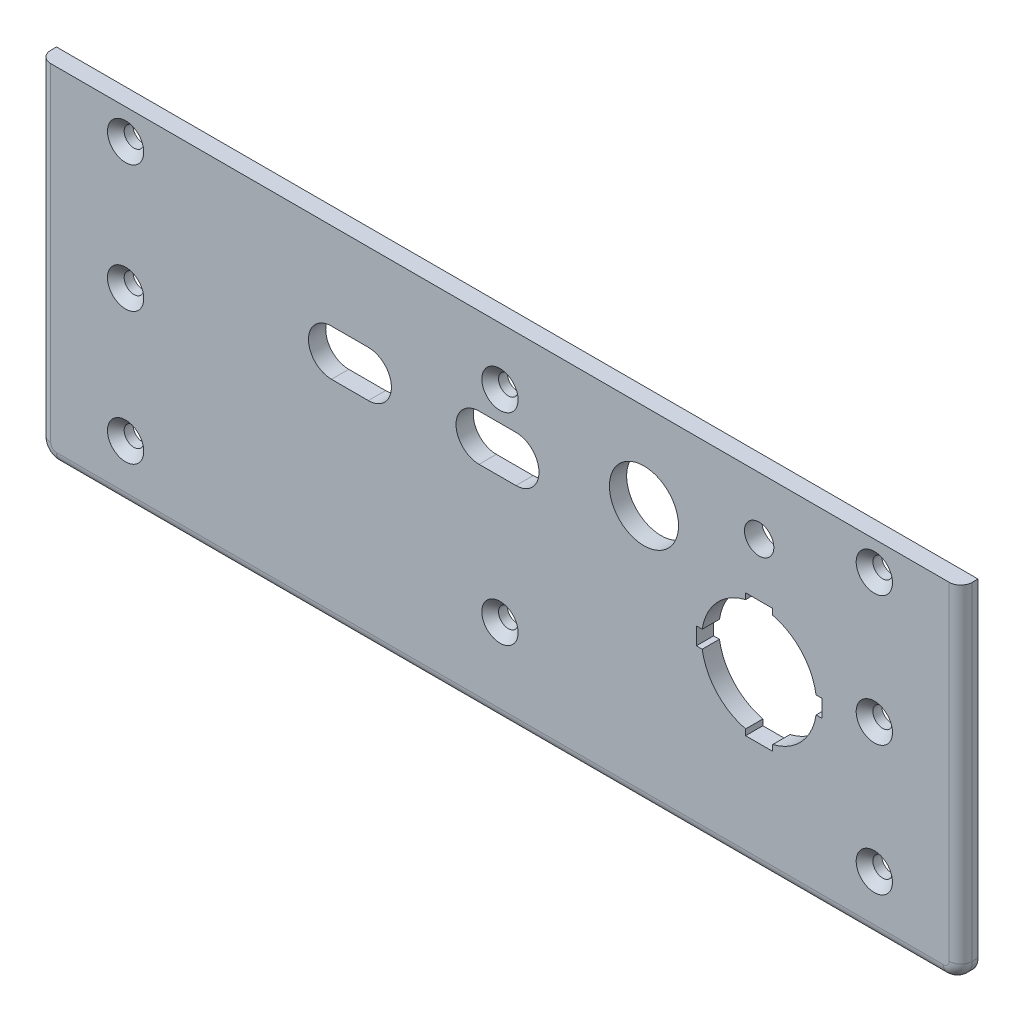
from build123d import *

# Parameters (mm, degrees)
SKETCH11_W                                     = 160
SKETCH11_H                                     = 60
SKETCH11_R                                     = 2.55
SKETCH11_R_2                                   = 6
BOSS_EXTRUDE1_DEPTH                            = 3
FILLET1_R                                      = 2
FILLET3_R                                      = 3
CSK_FOR_M3_FLAT_HEAD_MACHINE_SCREW1_AT_2_COUNT = 2
CSK_FOR_M3_FLAT_HEAD_MACHINE_SCREW1_AT_2_PITCH = 22.022525482
CSK_FOR_M3_FLAT_HEAD_MACHINE_SCREW1_AT_3_COUNT = 2
CSK_FOR_M3_FLAT_HEAD_MACHINE_SCREW1_AT_3_PITCH = 45
CSK_FOR_M3_FLAT_HEAD_MACHINE_SCREW1_AT_4_COUNT = 2
CSK_FOR_M3_FLAT_HEAD_MACHINE_SCREW1_AT_4_PITCH = 137.490256535
CSK_FOR_M3_FLAT_HEAD_MACHINE_SCREW1_AT_5_COUNT = 2
CSK_FOR_M3_FLAT_HEAD_MACHINE_SCREW1_AT_5_PITCH = 131.892243209
CSK_FOR_M3_FLAT_HEAD_MACHINE_SCREW1_AT_6_COUNT = 2
CSK_FOR_M3_FLAT_HEAD_MACHINE_SCREW1_AT_6_PITCH = 130.000219213
CSK_FOR_M3_FLAT_HEAD_MACHINE_SCREW1_AT_7_COUNT = 2
CSK_FOR_M3_FLAT_HEAD_MACHINE_SCREW1_AT_7_PITCH = 65.174148425
CSK_FOR_M3_FLAT_HEAD_MACHINE_SCREW1_AT_8_COUNT = 2
CSK_FOR_M3_FLAT_HEAD_MACHINE_SCREW1_AT_8_PITCH = 76.196837301


with BuildPart() as part:
    # Sketch11 → Boss-Extrude1 (new body)
    with BuildSketch(Plane.XY):
        with Locations((-80, 30)):
            Rectangle(SKETCH11_W, SKETCH11_H)
        with Locations((-35, 50)):
            Circle(SKETCH11_R, mode=Mode.SUBTRACT)
        with Locations((-55, 45)):
            Circle(SKETCH11_R_2, mode=Mode.SUBTRACT)
        with BuildLine():
            Line((-44.886859967, 31.5), (-45.897247359, 31.5))
            Line((-45.897247359, 31.5), (-45.897247359, 28.5))
            Line((-45.897247359, 28.5), (-44.886859967, 28.5))
            ThreePointArc((-44.886859967, 28.5), (-42.370691635, 23.241826814), (-37.35, 20.280046296))
            Line((-37.35, 20.280046296), (-37.35, 19.253954216))
            Line((-37.35, 19.253954216), (-32.65, 19.253954216))
            Line((-32.65, 19.253954216), (-32.65, 20.280046296))
            ThreePointArc((-32.65, 20.280046296), (-27.629308365, 23.241826814), (-25.113140033, 28.5))
            Line((-25.113140033, 28.5), (-24.102752641, 28.5))
            Line((-24.102752641, 28.5), (-24.102752641, 31.5))
            Line((-24.102752641, 31.5), (-25.113140033, 31.5))
            ThreePointArc((-25.113140033, 31.5), (-27.629308365, 36.758173186), (-32.65, 39.719953704))
            Line((-32.65, 39.719953704), (-32.65, 40.746045784))
            Line((-32.65, 40.746045784), (-37.35, 40.746045784))
            Line((-37.35, 40.746045784), (-37.35, 39.719953704))
            ThreePointArc((-37.35, 39.719953704), (-42.370691635, 36.758173186), (-44.886859967, 31.5))
        make_face(mode=Mode.SUBTRACT)
        with BuildLine():
            Line((-83.627304882, 44.930328357), (-77.227304882, 44.930328357))
            ThreePointArc((-77.227304882, 44.930328357), (-73.227304882, 40.930328357), (-77.227304882, 36.930328357))
            Line((-77.227304882, 36.930328357), (-83.627304882, 36.930328357))
            ThreePointArc((-83.627304882, 36.930328357), (-87.627304882, 40.930328357), (-83.627304882, 44.930328357))
        make_face(mode=Mode.SUBTRACT)
        with BuildLine():
            Line((-109.252753418, 44.9), (-102.852753418, 44.9))
            ThreePointArc((-102.852753418, 44.9), (-98.852753418, 40.9), (-102.852753418, 36.9))
            Line((-102.852753418, 36.9), (-109.252753418, 36.9))
            ThreePointArc((-109.252753418, 36.9), (-113.252753418, 40.9), (-109.252753418, 44.9))
        make_face(mode=Mode.SUBTRACT)
    extrude(amount=BOSS_EXTRUDE1_DEPTH)

    # Fillet1
    fillet1_edges = [part.edges().sort_by_distance(p)[0] for p in [
        (-160, 30, 3),
        (-80, 0, 3),
        (0, 30, 3),
    ]]
    fillet(fillet1_edges, radius=FILLET1_R)

    # Fillet3
    # the kernel refuses this fillet: 3 mm, written as the material it takes off along each edge
    with BuildSketch(Plane(origin=(-3, 3, 3), x_dir=(0, -1, 0), z_dir=(-1, 0, 0))) as fillet3_piece_1:
        with BuildLine():
            CenterArc((1, -2), 2, 0, 90)
            Line((3, -2), (3, 0))
            Line((3, 0), (1, 0))
        make_face()
    revolve(axis=Axis((-3, 3, 3), (0, 0, 1)), revolution_arc=90, mode=Mode.SUBTRACT)
    with BuildSketch(Plane(origin=(-157, 3, 3), x_dir=(-1, 0, 0), z_dir=(0, 1, 0))) as fillet3_piece_2:
        with BuildLine():
            CenterArc((1, -2), 2, 0, 90)
            Line((3, -2), (3, 0))
            Line((3, 0), (1, 0))
        make_face()
    revolve(axis=Axis((-157, 3, 3), (0, 0, 1)), revolution_arc=90, mode=Mode.SUBTRACT)
    with BuildSketch(Plane(origin=(0, 0, -7.5), x_dir=(-1, 0, 0), z_dir=(0, 0, 1))) as fillet3_piece_3:
        with BuildLine():
            CenterArc((FILLET3_R, -FILLET3_R), FILLET3_R, 90, 90)
            Line((0, -FILLET3_R), (0, 0))
            Line((0, 0), (FILLET3_R, 0))
        make_face()
    extrude(amount=10.5, mode=Mode.SUBTRACT)
    with BuildSketch(Plane(origin=(-160, 0, -7.5), x_dir=(1, 0, 0), z_dir=(0, 0, 1))) as fillet3_piece_4:
        with BuildLine():
            CenterArc((FILLET3_R, FILLET3_R), FILLET3_R, 180, 90)
            Line((0, FILLET3_R), (0, 0))
            Line((0, 0), (FILLET3_R, 0))
        make_face()
    extrude(amount=10.5, mode=Mode.SUBTRACT)

    # Sketch13 → CSK for M3 Flat Head Machine Screw1 (revolve, cut)
    with BuildSketch(Plane(origin=(-145, 54.761262741, 3), x_dir=(0, -1, 0), z_dir=(1, 0, 0))):
        Polygon((0, 0), (0, 3), (1.7, 3), (1.7, 1.45), (3.15, 0), align=None)
    csk_for_m3_flat_head_machine_screw1 = revolve(axis=Axis((-145, 54.761262741, 9.35), (0, 0, -1)), mode=Mode.SUBTRACT)

    # CSK for M3 Flat Head Machine Screw1 at 2: CSK for M3 Flat Head Machine Screw1 ×2
    with Locations(*[(0, -i * CSK_FOR_M3_FLAT_HEAD_MACHINE_SCREW1_AT_2_PITCH, 0) for i in range(1, CSK_FOR_M3_FLAT_HEAD_MACHINE_SCREW1_AT_2_COUNT)]):
        add(csk_for_m3_flat_head_machine_screw1, mode=Mode.SUBTRACT)

    # CSK for M3 Flat Head Machine Screw1 at 3: CSK for M3 Flat Head Machine Screw1 ×2
    with Locations(*[(0, -i * CSK_FOR_M3_FLAT_HEAD_MACHINE_SCREW1_AT_3_PITCH, 0) for i in range(1, CSK_FOR_M3_FLAT_HEAD_MACHINE_SCREW1_AT_3_COUNT)]):
        add(csk_for_m3_flat_head_machine_screw1, mode=Mode.SUBTRACT)

    # CSK for M3 Flat Head Machine Screw1 at 4: CSK for M3 Flat Head Machine Screw1 ×2
    with Locations(*[Vector(0.9455215465875816, -0.3255595259528246, 0) * (i * CSK_FOR_M3_FLAT_HEAD_MACHINE_SCREW1_AT_4_PITCH) for i in range(1, CSK_FOR_M3_FLAT_HEAD_MACHINE_SCREW1_AT_4_COUNT)]):
        add(csk_for_m3_flat_head_machine_screw1, mode=Mode.SUBTRACT)

    # CSK for M3 Flat Head Machine Screw1 at 5: CSK for M3 Flat Head Machine Screw1 ×2
    with Locations(*[Vector(0.9856531122424032, -0.16878371463759412, 0) * (i * CSK_FOR_M3_FLAT_HEAD_MACHINE_SCREW1_AT_5_PITCH) for i in range(1, CSK_FOR_M3_FLAT_HEAD_MACHINE_SCREW1_AT_5_COUNT)]):
        add(csk_for_m3_flat_head_machine_screw1, mode=Mode.SUBTRACT)

    # CSK for M3 Flat Head Machine Screw1 at 6: CSK for M3 Flat Head Machine Screw1 ×2
    with Locations(*[Vector(0.9999983137474917, 0.0018364373589019598, 0) * (i * CSK_FOR_M3_FLAT_HEAD_MACHINE_SCREW1_AT_6_PITCH) for i in range(1, CSK_FOR_M3_FLAT_HEAD_MACHINE_SCREW1_AT_6_COUNT)]):
        add(csk_for_m3_flat_head_machine_screw1, mode=Mode.SUBTRACT)

    # CSK for M3 Flat Head Machine Screw1 at 7: CSK for M3 Flat Head Machine Screw1 ×2
    with Locations(*[Vector(0.9973279524332378, -0.0730544680038502, 0) * (i * CSK_FOR_M3_FLAT_HEAD_MACHINE_SCREW1_AT_7_PITCH) for i in range(1, CSK_FOR_M3_FLAT_HEAD_MACHINE_SCREW1_AT_7_COUNT)]):
        add(csk_for_m3_flat_head_machine_screw1, mode=Mode.SUBTRACT)

    # CSK for M3 Flat Head Machine Screw1 at 8: CSK for M3 Flat Head Machine Screw1 ×2
    with Locations(*[Vector(0.8530537788971958, -0.5218230066882967, 0) * (i * CSK_FOR_M3_FLAT_HEAD_MACHINE_SCREW1_AT_8_PITCH) for i in range(1, CSK_FOR_M3_FLAT_HEAD_MACHINE_SCREW1_AT_8_COUNT)]):
        add(csk_for_m3_flat_head_machine_screw1, mode=Mode.SUBTRACT)


solid = part.part
